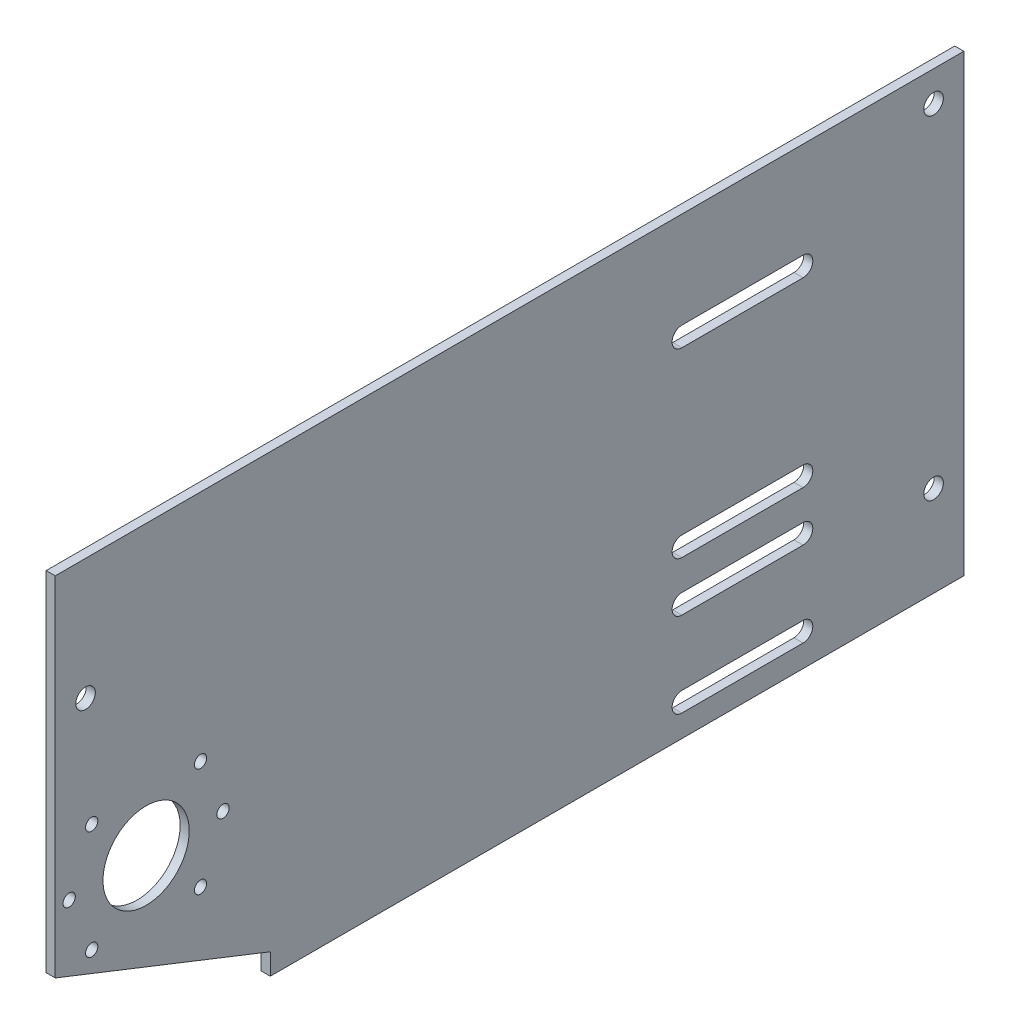
from build123d import *

# Parameters (mm, degrees)
SKETCH1_W           = 300
SKETCH1_H           = 150
SKETCH1_R           = 14.235
BOSS_EXTRUDE1_DEPTH = 3
CUT_EXTRUDE1_REACH  = 337.424
SKETCH2_R           = 3.225
SKETCH4_R           = 2.0193
CUT_EXTRUDE4_DEPTH  = 336.423612765
CUT_EXTRUDE5_DEPTH  = 336.423612765


with BuildPart() as part:
    # Sketch1 → Boss-Extrude1 (new body)
    with BuildSketch(Plane(origin=(0, 0, 0), x_dir=(0, 0, -1), z_dir=(1, 0, 0))):
        with Locations((150, 75)):
            Rectangle(SKETCH1_W, SKETCH1_H)
        with Locations((30, 55)):
            Circle(SKETCH1_R, mode=Mode.SUBTRACT)
    extrude(amount=BOSS_EXTRUDE1_DEPTH)

    # Sketch2 → Cut-Extrude1 (cut, up to next)
    with BuildSketch(Plane.ZY, mode=Mode.PRIVATE) as cut_extrude1_sk1:
        with Locations((-290, 140)):
            Circle(SKETCH2_R)
    cut_extrude1_tool1 = extrude(cut_extrude1_sk1.sketch, amount=-CUT_EXTRUDE1_REACH, mode=Mode.PRIVATE) & part.part
    # Sketch2 → Cut-Extrude1 (cut, up to next)
    with BuildSketch(Plane.ZY, mode=Mode.PRIVATE) as cut_extrude1_sk2:
        with Locations((-10, 110)):
            Circle(SKETCH2_R)
    cut_extrude1_tool2 = extrude(cut_extrude1_sk2.sketch, amount=-CUT_EXTRUDE1_REACH, mode=Mode.PRIVATE) & part.part
    # Sketch2 → Cut-Extrude1 (cut, up to next)
    with BuildSketch(Plane.ZY, mode=Mode.PRIVATE) as cut_extrude1_sk3:
        with Locations((-290, 30)):
            Circle(SKETCH2_R)
    cut_extrude1_tool3 = extrude(cut_extrude1_sk3.sketch, amount=-CUT_EXTRUDE1_REACH, mode=Mode.PRIVATE) & part.part
    # Sketch2 → Cut-Extrude1 (cut, up to next)
    with BuildSketch(Plane.ZY, mode=Mode.PRIVATE) as cut_extrude1_sk4:
        with BuildLine():
            Line((-246.901029004, 58.225), (-206.901029004, 58.225))
            ThreePointArc((-206.901029004, 58.225), (-203.676029004, 55), (-206.901029004, 51.775))
            Line((-206.901029004, 51.775), (-246.901029004, 51.775))
            ThreePointArc((-246.901029004, 51.775), (-250.126029004, 55), (-246.901029004, 58.225))
        make_face()
    cut_extrude1_tool4 = extrude(cut_extrude1_sk4.sketch, amount=-CUT_EXTRUDE1_REACH, mode=Mode.PRIVATE) & part.part
    # Sketch2 → Cut-Extrude1 (cut, up to next)
    with BuildSketch(Plane.ZY, mode=Mode.PRIVATE) as cut_extrude1_sk5:
        with BuildLine():
            Line((-206.901029004, 111.77), (-246.901029004, 111.77))
            ThreePointArc((-246.901029004, 111.77), (-250.131029004, 115), (-246.901029004, 118.23))
            Line((-246.901029004, 118.23), (-206.901029004, 118.23))
            ThreePointArc((-206.901029004, 118.23), (-203.671029004, 115), (-206.901029004, 111.77))
        make_face()
    cut_extrude1_tool5 = extrude(cut_extrude1_sk5.sketch, amount=-CUT_EXTRUDE1_REACH, mode=Mode.PRIVATE) & part.part
    # Sketch2 → Cut-Extrude1 (cut, up to next)
    with BuildSketch(Plane.ZY, mode=Mode.PRIVATE) as cut_extrude1_sk6:
        with BuildLine():
            Line((-246.901029004, 41.775), (-206.901029004, 41.775))
            ThreePointArc((-206.901029004, 41.775), (-203.676029004, 38.55), (-206.901029004, 35.325))
            Line((-206.901029004, 35.325), (-246.901029004, 35.325))
            ThreePointArc((-246.901029004, 35.325), (-250.126029004, 38.55), (-246.901029004, 41.775))
        make_face()
    cut_extrude1_tool6 = extrude(cut_extrude1_sk6.sketch, amount=-CUT_EXTRUDE1_REACH, mode=Mode.PRIVATE) & part.part
    # Sketch2 → Cut-Extrude1 (cut, up to next)
    with BuildSketch(Plane.ZY, mode=Mode.PRIVATE) as cut_extrude1_sk7:
        with BuildLine():
            Line((-246.901029004, 13.775), (-206.901029004, 13.775))
            ThreePointArc((-206.901029004, 13.775), (-203.676029004, 10.55), (-206.901029004, 7.325))
            Line((-206.901029004, 7.325), (-246.901029004, 7.325))
            ThreePointArc((-246.901029004, 7.325), (-250.126029004, 10.55), (-246.901029004, 13.775))
        make_face()
    cut_extrude1_tool7 = extrude(cut_extrude1_sk7.sketch, amount=-CUT_EXTRUDE1_REACH, mode=Mode.PRIVATE) & part.part
    add(cut_extrude1_tool1.solids().sort_by_distance((0, 140, -290))[0], mode=Mode.SUBTRACT)
    add(cut_extrude1_tool2.solids().sort_by_distance((0, 110, -10))[0], mode=Mode.SUBTRACT)
    add(cut_extrude1_tool3.solids().sort_by_distance((0, 30, -290))[0], mode=Mode.SUBTRACT)
    add(cut_extrude1_tool4.solids().sort_by_distance((0, 55, -226.901029))[0], mode=Mode.SUBTRACT)
    add(cut_extrude1_tool5.solids().sort_by_distance((0, 115, -226.901029))[0], mode=Mode.SUBTRACT)
    add(cut_extrude1_tool6.solids().sort_by_distance((0, 38.55, -226.901029))[0], mode=Mode.SUBTRACT)
    add(cut_extrude1_tool7.solids().sort_by_distance((0, 10.55, -226.901029))[0], mode=Mode.SUBTRACT)

    # Sketch4 → Cut-Extrude4 (cut, through all)
    with BuildSketch(Plane(origin=(3, 0, 0), x_dir=(0, 0, -1), z_dir=(1, 0, 0))):
        with Locations((47.960512242, 37.039487758)):
            Circle(SKETCH4_R)
        with Locations((47.960512242, 72.960512242)):
            Circle(SKETCH4_R)
        with Locations((55.4, 55)):
            Circle(SKETCH4_R)
        with Locations((12.039487758, 72.960512242)):
            Circle(SKETCH4_R)
        with Locations((4.6, 55)):
            Circle(SKETCH4_R)
        with Locations((12.039487758, 37.039487758)):
            Circle(SKETCH4_R)
    extrude(amount=-CUT_EXTRUDE4_DEPTH, mode=Mode.SUBTRACT)

    # Sketch5 → Cut-Extrude5 (cut, through all)
    with BuildSketch(Plane.ZY):
        Polygon((-71, 7), (0, 35), (0, 0), (-71, 0), align=None)
    extrude(amount=-CUT_EXTRUDE5_DEPTH, mode=Mode.SUBTRACT)


solid = part.part
